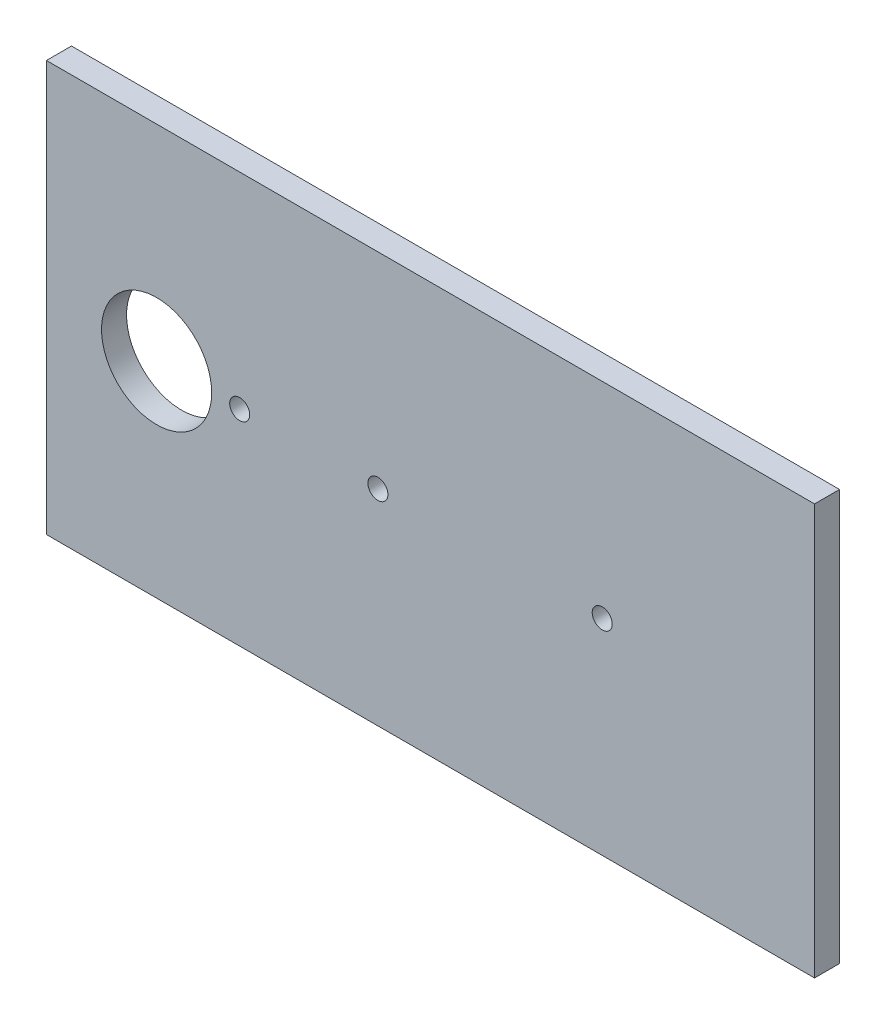
from build123d import *

# Parameters (mm, degrees)
SKETCH_1_W      = 153.4
SKETCH_1_H      = 82
SKETCH_1_R      = 2
SKETCH_1_R_2    = 11
EXTRUDE_1_DEPTH = 5


with BuildPart() as part:
    # Эскиз1 → Бобышка-Вытянуть1 (new body)
    with BuildSketch(Plane.XY):
        with Locations((76.7, 41)):
            Rectangle(SKETCH_1_W, SKETCH_1_H)
        with Locations((111, 41)):
            Circle(SKETCH_1_R, mode=Mode.SUBTRACT)
        with Locations((66.2, 41)):
            Circle(SKETCH_1_R, mode=Mode.SUBTRACT)
        with Locations((38.6, 41)):
            Circle(SKETCH_1_R, mode=Mode.SUBTRACT)
        with Locations((22, 41)):
            Circle(SKETCH_1_R_2, mode=Mode.SUBTRACT)
    extrude(amount=EXTRUDE_1_DEPTH)


solid = part.part
